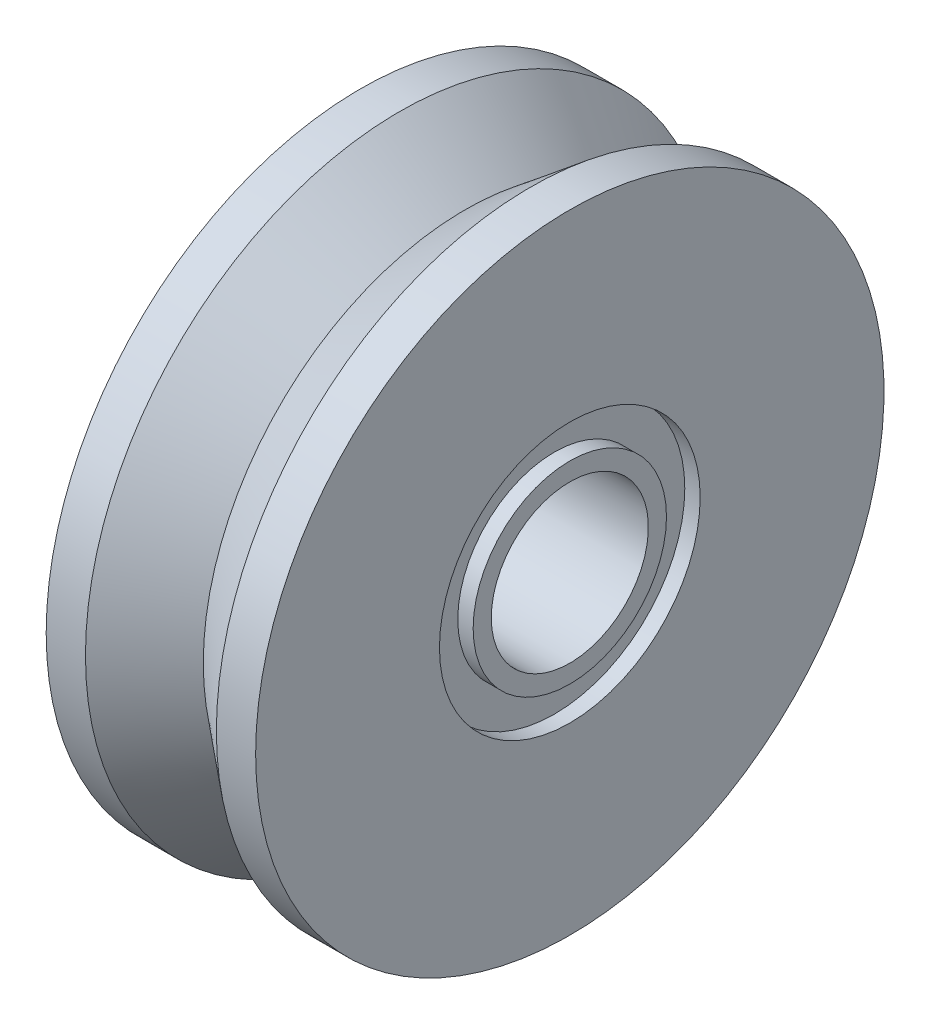
from build123d import *


with BuildPart() as part:
    # Sketch1 → Revolve1 (revolve)
    with BuildSketch(Plane.XY):
        Polygon((0, 6), (0.75, 6), (2, 5), (3.25, 6), (4, 6), (4, 2.48951049), (3.706293706, 2.48951049), (3.706293706, 1.846153846), (4, 1.846153846), (4, 1.5), (0, 1.5), (0, 1.846153846), (0.293706294, 1.846153846), (0.293706294, 2.48951049), (0, 2.48951049), align=None)
    revolve(axis=Axis((0, 0, 0), (1, 0, 0)))


solid = part.part
